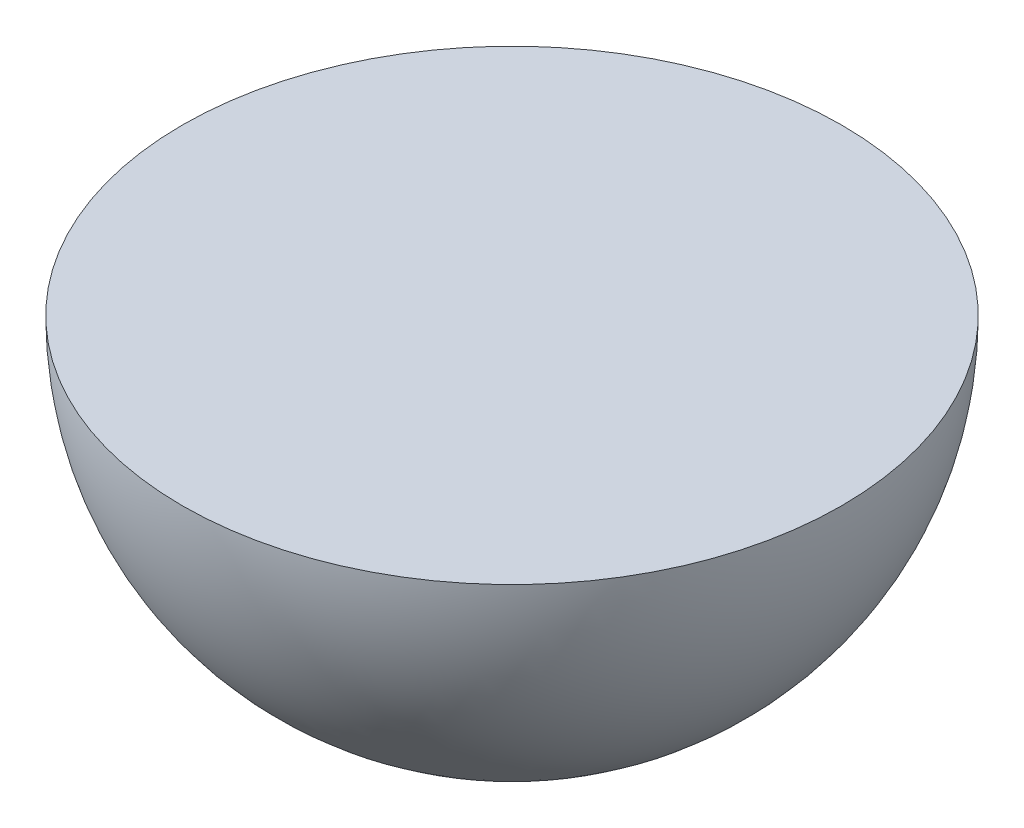
from build123d import *


with BuildPart() as part:
    # Sketch1 → Revolve1 (revolve)
    with BuildSketch(Plane.XY):
        with BuildLine():
            Line((0, -4), (0, 0))
            Line((0, 0), (-4, 0))
            ThreePointArc((-4, 0), (-2.828427125, -2.828427125), (0, -4))
        make_face()
    revolve(axis=Axis((0, 1.710720211, 0), (0, -1, 0)))


solid = part.part
